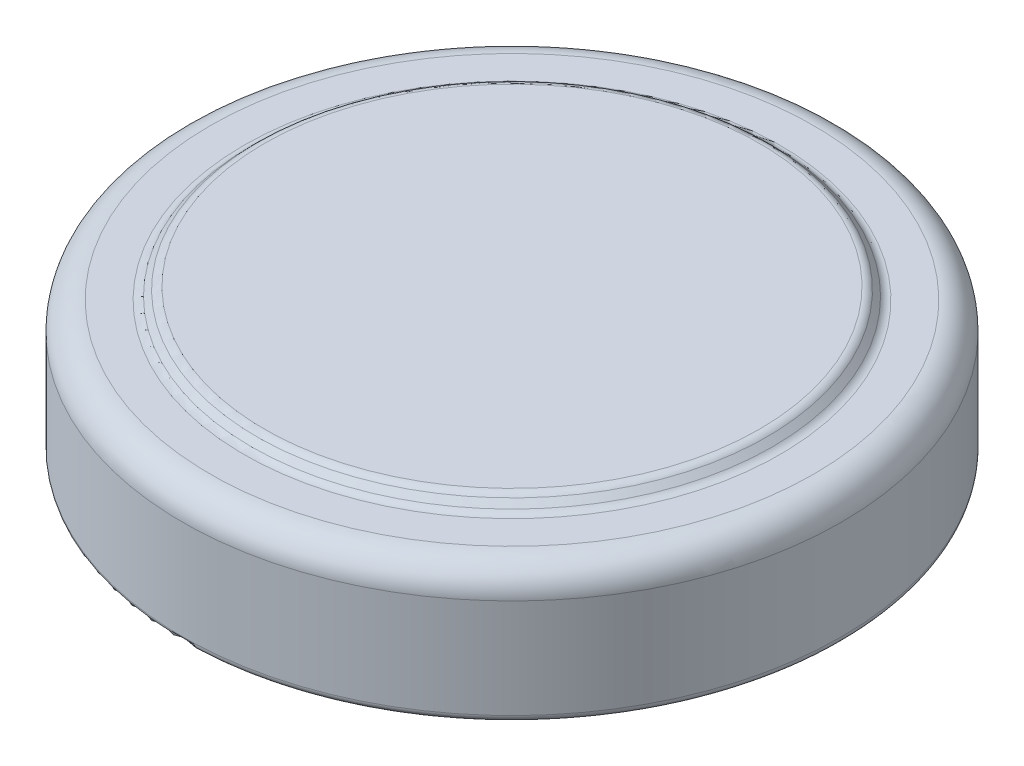
from build123d import *


with BuildPart() as part:
    # Sketch1 → Revolve1 (revolve)
    with BuildSketch(Plane.XY):
        with BuildLine():
            Line((0, 0), (-4.65, 0))
            ThreePointArc((-4.65, 0), (-4.720710678, 0.029289322), (-4.75, 0.1))
            Line((-4.75, 0.1), (-4.75, 1.53))
            ThreePointArc((-4.75, 1.53), (-4.632842712, 1.812842712), (-4.35, 1.93))
            Line((-4.35, 1.93), (-3.862132034, 1.93))
            ThreePointArc((-3.862132034, 1.93), (-3.80472952, 1.94141807), (-3.756066017, 1.973933983))
            Line((-3.756066017, 1.973933983), (-3.673933983, 2.056066017))
            ThreePointArc((-3.673933983, 2.056066017), (-3.62527048, 2.08858193), (-3.567867966, 2.1))
            Line((-3.567867966, 2.1), (0, 2.1))
            Line((0, 2.1), (0, 0))
        make_face()
    revolve(axis=Axis((0, 2.1, 0), (0, -1, 0)))


solid = part.part
